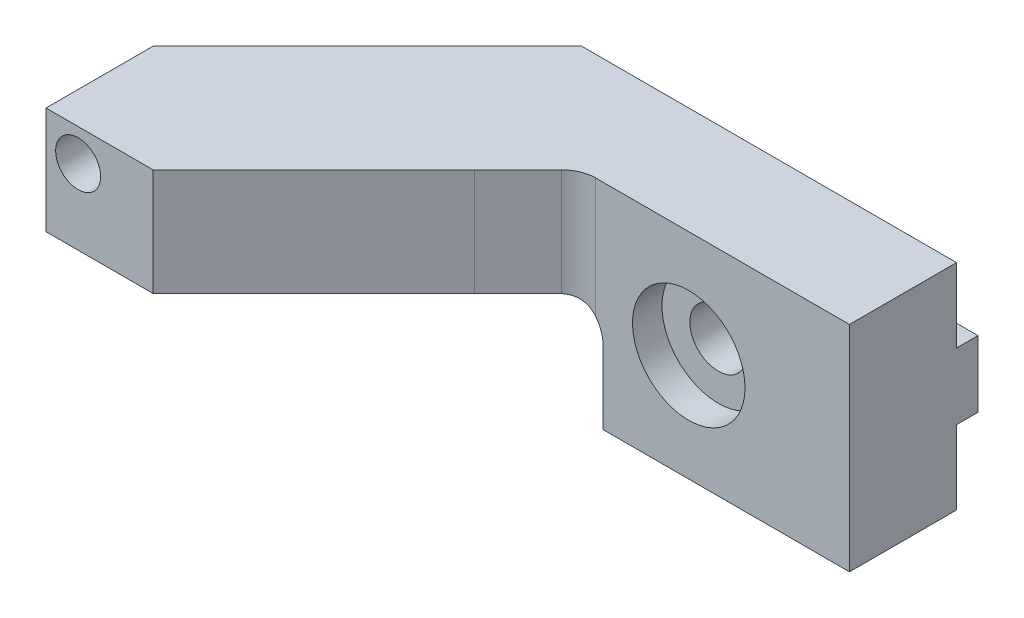
from build123d import *

# Parameters (mm, degrees)
SKETCH1_W                  = 15
SKETCH1_H                  = 20
BOSS_EXTRUDE1_DEPTH        = 10
F_4_2_4_2_DIAMETER_HOLE1_D = 4.2
SKETCH4_W                  = 10
SKETCH4_H                  = 20
BOSS_EXTRUDE2_DEPTH        = 15
SKETCH5_W                  = 15
SKETCH5_H                  = 20
BOSS_EXTRUDE3_DEPTH        = 20
CHAMFER1_SIZE              = 10
CHAMFER2_SIZE              = 15
SKETCH6_W                  = 5
SKETCH6_H                  = 20
CUT_EXTRUDE1_DEPTH         = 10
SKETCH8_W                  = 15
SKETCH8_H                  = 20
BOSS_EXTRUDE4_DEPTH        = 10
CHAMFER3_SIZE              = 10
SKETCH7_W                  = 10
SKETCH7_H                  = 20
BOSS_EXTRUDE5_DEPTH        = 25
FILLET5_R                  = 3.175
SKETCH9_W                  = 10
SKETCH9_H                  = 10
CUT_EXTRUDE4_DEPTH         = 37
SKETCH15_W                 = 35.287710309
SKETCH15_H                 = 35.27052657
CUT_EXTRUDE5_DEPTH         = 10
SKETCH16_W                 = 32
SKETCH16_H                 = 10
CUT_EXTRUDE6_DEPTH         = 46
MOVE_FACE1_BY              = 5
SKETCH19_W                 = 2
SKETCH19_H                 = 6.2
BOSS_EXTRUDE6_DEPTH        = 2
FILLET6_R                  = 6.35
FILLET7_R                  = 3.175


# Some blends are built 0.0001 mm under size
with BuildPart() as part:
    # Sketch1 → Boss-Extrude1 (new body)
    with BuildSketch(Plane.XY):
        with Locations((7.5, 10)):
            Rectangle(SKETCH1_W, SKETCH1_H)
    extrude(amount=BOSS_EXTRUDE1_DEPTH)

    # Ø4.2 (4.2) Diameter Hole1 (through all)
    with Locations(Plane.XY.offset(10)):
        with Locations((8, 17)):
            Hole(F_4_2_4_2_DIAMETER_HOLE1_D / 2)

    # Sketch4 → Boss-Extrude2 (add)
    with BuildSketch(Plane(origin=(15, 0, 0), x_dir=(0, 0, -1), z_dir=(1, 0, 0))):
        with Locations((-5, 10)):
            Rectangle(SKETCH4_W, SKETCH4_H)
    extrude(amount=BOSS_EXTRUDE2_DEPTH)

    # Sketch5 → Boss-Extrude3 (add)
    with BuildSketch(Plane(origin=(0, 0, 0), x_dir=(-1, 0, 0), z_dir=(0, 0, -1))):
        with Locations((-22.5, 10)):
            Rectangle(SKETCH5_W, SKETCH5_H)
    extrude(amount=BOSS_EXTRUDE3_DEPTH)

    # Chamfer1
    # the kernel refuses this chamfer: 10 mm, written as the material it adds along each edge
    with BuildSketch(Plane(origin=(15, 20, 0), x_dir=(-0.9996219169112968, 0, 0.027495876610586372), z_dir=(0, -1, 0))) as chamfer1_piece_1_section:
        Polygon((CHAMFER1_SIZE * 0.999621916911, CHAMFER1_SIZE * 0.0274958766106), (-CHAMFER1_SIZE * 0.0274958766106, CHAMFER1_SIZE * 0.999621916911), (0, 0), align=None)
    chamfer1_piece_1 = extrude(amount=20, mode=Mode.PRIVATE)
    chamfer1_piece_1 = chamfer1_piece_1 - Plane(origin=(8, 17, -3.373966189), x_dir=(-1, 0, 0), z_dir=(0, 0, -1)) * Cylinder(2.1, 80, mode=Mode.PRIVATE)
    add(chamfer1_piece_1)

    # Chamfer2
    chamfer2_edges = [part.edges().sort_by_distance(p)[0] for p in [
        (30, 10, 10),
    ]]
    chamfer(chamfer2_edges, length=CHAMFER2_SIZE)

    # Sketch6 → Cut-Extrude1 (cut)
    with BuildSketch(Plane(origin=(0, 0, 0), x_dir=(-1, 0, 0), z_dir=(0, 0, -1))):
        with Locations((-2.5, 10)):
            Rectangle(SKETCH6_W, SKETCH6_H)
    extrude(amount=-CUT_EXTRUDE1_DEPTH, mode=Mode.SUBTRACT)

    # Sketch8 → Boss-Extrude4 (add)
    with BuildSketch(Plane(origin=(30, 0, 0), x_dir=(0, 0, -1), z_dir=(1, 0, 0))):
        with Locations((12.5, 10)):
            Rectangle(SKETCH8_W, SKETCH8_H)
    extrude(amount=BOSS_EXTRUDE4_DEPTH)

    # Chamfer3
    chamfer3_edges = [part.edges().sort_by_distance(p)[0] for p in [
        (40, 10, -5),
    ]]
    chamfer(chamfer3_edges, length=CHAMFER3_SIZE - 0.0001)  # a hair under: the kernel refuses the full size

    # Sketch7 → Boss-Extrude5 (add)
    with BuildSketch(Plane(origin=(30, 0, 0), x_dir=(0, 0, -1), z_dir=(1, 0, 0))):
        with Locations((15, 10)):
            Rectangle(SKETCH7_W, SKETCH7_H)
    extrude(amount=BOSS_EXTRUDE5_DEPTH)

    # Fillet5
    fillet5_edges = [part.edges().sort_by_distance(p)[0] for p in [
        (35.0001, 10, -10),
    ]]
    fillet(fillet5_edges, radius=FILLET5_R)

    # Sketch9 → Cut-Extrude4 (cut)
    with BuildSketch(Plane(origin=(0, 0, -20), x_dir=(-1, 0, 0), z_dir=(0, 0, -1))):
        with Locations((-10, 5)):
            Rectangle(SKETCH9_W, SKETCH9_H)
    extrude(amount=-CUT_EXTRUDE4_DEPTH, mode=Mode.SUBTRACT)

    # Sketch14 → CBORE for M5 SBHCS2 (revolve, cut)
    with BuildSketch(Plane(origin=(45, 10, 10), x_dir=(0, -1, 0), z_dir=(1, 0, 0))):
        Polygon((0, 0), (0, 30), (2.65, 30), (2.65, 22.75), (5.25, 22.75), (5.25, 0.020977491), (5.275, 0), align=None)
    revolve(axis=Axis((45, 10, 16.35), (0, 0, -1)), mode=Mode.SUBTRACT)

    # Sketch15 → Cut-Extrude5 (cut)
    with BuildSketch(Plane(origin=(2.5, 0, 2.5), x_dir=(-0.707106781186544, 0, 0.7071067811865511), z_dir=(-0.7071067811865511, 0, -0.707106781186544))):
        with Locations((-14.684853065, 9.385409348)):
            Rectangle(SKETCH15_W, SKETCH15_H)
    extrude(amount=CUT_EXTRUDE5_DEPTH, mode=Mode.SUBTRACT)

    # Sketch16 → Cut-Extrude6 (cut)
    with BuildSketch(Plane(origin=(0, 0, -20), x_dir=(-1, 0, 0), z_dir=(0, 0, -1))):
        with Locations((-21, 5)):
            Rectangle(SKETCH16_W, SKETCH16_H)
    extrude(amount=-CUT_EXTRUDE6_DEPTH, mode=Mode.SUBTRACT)

    # Move Face1: a face moved outward by 5.0
    extrude(part.faces().sort_by_distance((55, 10, -15))[0], amount=MOVE_FACE1_BY, dir=(1, 0, 0))

    # Sketch19 → Boss-Extrude6 (add)
    with BuildSketch(Plane(origin=(0, 0, -20), x_dir=(-1, 0, 0), z_dir=(0, 0, -1))):
        with Locations((-59, 10)):
            Rectangle(SKETCH19_W, SKETCH19_H)
    extrude(amount=BOSS_EXTRUDE6_DEPTH)

    # Fillet6
    # the kernel refuses this fillet: 6.35 mm, written as the material it adds along each edge
    with BuildSketch(Plane(origin=(58, 13.1, -20), x_dir=(-1, 0, 0), z_dir=(0, -1, 0))) as fillet6_piece_1:
        with BuildLine():
            CenterArc((4.626013402, 6.35), FILLET6_R, 223.238703461, 46.761296539)
            Line((0, 2), (-0.092520268, 1.913))
            ThreePointArc((-0.092520268, 1.913), (-0.127, 1), (-0.127, 0))
            Line((-0.127, 0), (0, -0.127))
            Line((0, -0.127), (4.626013402, -0.127))
            Line((4.626013402, -0.127), (4.626013402, 0))
        make_face()
    extrude(amount=6.2)

    # Fillet7
    fillet7_edges = [part.edges().sort_by_distance(p)[0] for p in [
        (37, 10, -15),
    ]]
    fillet(fillet7_edges, radius=FILLET7_R)


solid = part.part
